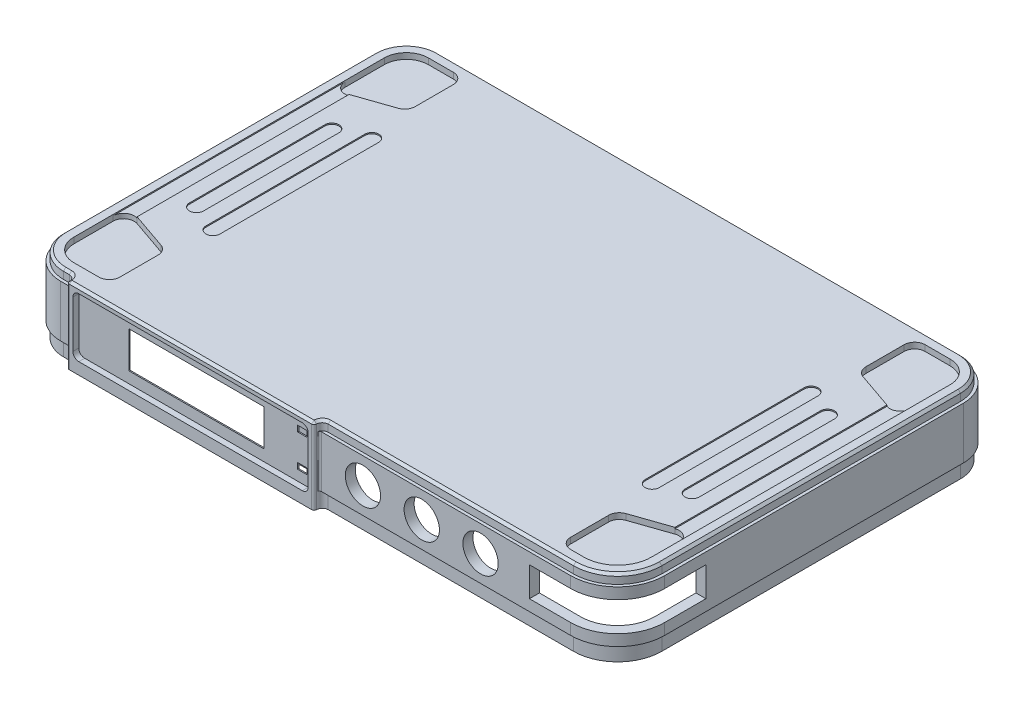
from build123d import *

# Parameters (mm, degrees)
BOSS_EXTRUDE1_DEPTH = 13
CUT_EXTRUDE1_DEPTH  = 1
CUT_EXTRUDE2_DEPTH  = 0.2
CUT_EXTRUDE3_START  = -1.6
CUT_EXTRUDE3_DEPTH  = 1.6
CUT_EXTRUDE4_DEPTH  = 2.6
SKETCH7_W           = 42
SKETCH7_H           = 13
BOSS_EXTRUDE2_DEPTH = 1.4
CUT_EXTRUDE6_DEPTH  = 0.5
CUT_EXTRUDE7_DEPTH  = 1
SKETCH10_R          = 6.5
CUT_EXTRUDE8_DEPTH  = 0.5
FILLET1_R           = 0.4
FILLET2_R           = 1
CHAMFER1_SIZE       = 0.4
CUT_EXTRUDE9_DEPTH  = 11.5
SKETCH12_W          = 23
SKETCH12_H          = 6.2
SKETCH12_W_2        = 1.6
SKETCH12_H_2        = 1
CUT_EXTRUDE10_DEPTH = 12
SKETCH13_R          = 4
CUT_EXTRUDE11_DEPTH = 12
SKETCH14_R          = 2.25
CUT_EXTRUDE12_DEPTH = 12
SKETCH15_R          = 3
SKETCH15_W          = 15
SKETCH15_H          = 5
CUT_EXTRUDE13_DEPTH = 15
BOSS_EXTRUDE6_START = 8.5
SKETCH18_W          = 5.6
SKETCH18_H          = 3
SKETCH18_R          = 0.8
BOSS_EXTRUDE6_DEPTH = 8.5
FILLET6_R           = 1
SKETCH19_R          = 0.6
BOSS_EXTRUDE7_DEPTH = 1.4
CHAMFER2_SIZE       = 0.4
SKETCH20_W          = 1.6
SKETCH20_H          = 1
CUT_EXTRUDE14_DEPTH = 1.1
BOSS_EXTRUDE9_DEPTH = 1


with BuildPart() as part:
    # Sketch1 → Boss-Extrude1 (new body)
    with BuildSketch(Plane(origin=(0, 0, 0), x_dir=(1, 0, 0), z_dir=(0, 1, 0))):
        with BuildLine():
            Line((44.35, 32.39), (-44.35, 32.39))
            ThreePointArc((-44.35, 32.39), (-48.592640687, 30.632640687), (-50.35, 26.39))
            Line((-50.35, 26.39), (-50.35, -26.39))
            ThreePointArc((-50.35, -26.39), (-48.592640687, -30.632640687), (-44.35, -32.39))
            Line((-44.35, -32.39), (42.35, -32.39))
            ThreePointArc((42.35, -32.39), (48.006854249, -30.046854249), (50.35, -24.39))
            Line((50.35, -24.39), (50.35, 26.39))
            ThreePointArc((50.35, 26.39), (48.592640687, 30.632640687), (44.35, 32.39))
        make_face()
    extrude(amount=BOSS_EXTRUDE1_DEPTH)

    # Sketch3 → Cut-Extrude1 (cut)
    with BuildSketch(Plane(origin=(0, 13, 0), x_dir=(1, 0, 0), z_dir=(0, 1, 0))):
        with BuildLine():
            Line((-44.35, -30.13894271), (-40.09894271, -30.13894271))
            ThreePointArc((-40.09894271, -30.13894271), (-38.826150504, -29.611734916), (-38.29894271, -28.33894271))
            Line((-38.29894271, -28.33894271), (-38.29894271, -21.854017959))
            ThreePointArc((-38.29894271, -21.854017959), (-38.633270046, -20.809123878), (-39.512057867, -20.152381635))
            Line((-39.512057867, -20.152381635), (-45.712057867, -18.01403634))
            ThreePointArc((-45.712057867, -18.01403634), (-47.343836791, -18.25), (-48.09894271, -19.715672664))
            Line((-48.09894271, -19.715672664), (-48.09894271, -26.39))
            ThreePointArc((-48.09894271, -26.39), (-47.000902813, -29.040902813), (-44.35, -30.13894271))
        make_face()
        with BuildLine():
            ThreePointArc((48.09894271, -24.39), (46.415116375, -28.455116375), (42.35, -30.13894271))
            Line((42.35, -30.13894271), (40.09894271, -30.13894271))
            ThreePointArc((40.09894271, -30.13894271), (38.826150504, -29.611734916), (38.29894271, -28.33894271))
            Line((38.29894271, -28.33894271), (38.29894271, -21.854017959))
            ThreePointArc((38.29894271, -21.854017959), (38.633270046, -20.809123878), (39.512057867, -20.152381635))
            Line((39.512057867, -20.152381635), (45.712057867, -18.01403634))
            ThreePointArc((45.712057867, -18.01403634), (47.343836791, -18.25), (48.09894271, -19.715672664))
            Line((48.09894271, -19.715672664), (48.09894271, -24.39))
        make_face()
        with BuildLine():
            Line((44.35, 30.13894271), (40.09894271, 30.13894271))
            ThreePointArc((40.09894271, 30.13894271), (38.826150504, 29.611734916), (38.29894271, 28.33894271))
            Line((38.29894271, 28.33894271), (38.29894271, 21.854017959))
            ThreePointArc((38.29894271, 21.854017959), (38.633270046, 20.809123878), (39.512057867, 20.152381635))
            Line((39.512057867, 20.152381635), (45.712057867, 18.01403634))
            ThreePointArc((45.712057867, 18.01403634), (47.343836791, 18.25), (48.09894271, 19.715672664))
            Line((48.09894271, 19.715672664), (48.09894271, 26.39))
            ThreePointArc((48.09894271, 26.39), (47.000902813, 29.040902813), (44.35, 30.13894271))
        make_face()
        with BuildLine():
            ThreePointArc((-48.09894271, 26.39), (-47.000902813, 29.040902813), (-44.35, 30.13894271))
            Line((-44.35, 30.13894271), (-40.09894271, 30.13894271))
            ThreePointArc((-40.09894271, 30.13894271), (-38.826150504, 29.611734916), (-38.29894271, 28.33894271))
            Line((-38.29894271, 28.33894271), (-38.29894271, 21.854017959))
            ThreePointArc((-38.29894271, 21.854017959), (-38.633270046, 20.809123878), (-39.512057867, 20.152381635))
            Line((-39.512057867, 20.152381635), (-45.712057867, 18.01403634))
            ThreePointArc((-45.712057867, 18.01403634), (-47.343836791, 18.25), (-48.09894271, 19.715672664))
            Line((-48.09894271, 19.715672664), (-48.09894271, 26.39))
        make_face()
    extrude(amount=-CUT_EXTRUDE1_DEPTH, mode=Mode.SUBTRACT)

    # Sketch4 → Cut-Extrude2 (cut)
    with BuildSketch(Plane(origin=(0, 13, 0), x_dir=(1, 0, 0), z_dir=(0, 1, 0))):
        with BuildLine():
            Line((-48.09894271, 19.715672664), (-48.09894271, -19.715672664))
            ThreePointArc((-48.09894271, -19.715672664), (-47.343836791, -18.25), (-45.712057867, -18.01403634))
            Line((-45.712057867, -18.01403634), (-45.712057867, 18.01403634))
            ThreePointArc((-45.712057867, 18.01403634), (-47.343836791, 18.25), (-48.09894271, 19.715672664))
        make_face()
        with BuildLine():
            Line((-40.925173024, 11.506557578), (-40.925173024, -11.506557578))
            ThreePointArc((-40.925173024, -11.506557578), (-42.118615445, -12.7), (-43.312057867, -11.506557578))
            Line((-43.312057867, -11.506557578), (-43.312057867, 11.506557578))
            ThreePointArc((-43.312057867, 11.506557578), (-42.118615445, 12.7), (-40.925173024, 11.506557578))
        make_face()
        with BuildLine():
            Line((-36.13828818, 13.506557578), (-36.13828818, -13.506557578))
            ThreePointArc((-36.13828818, -13.506557578), (-37.331730602, -14.7), (-38.525173024, -13.506557578))
            Line((-38.525173024, -13.506557578), (-38.525173024, 13.506557578))
            ThreePointArc((-38.525173024, 13.506557578), (-37.331730602, 14.7), (-36.13828818, 13.506557578))
        make_face()
        with BuildLine():
            Line((40.925173024, 11.506557578), (40.925173024, -11.506557578))
            ThreePointArc((40.925173024, -11.506557578), (42.118615445, -12.7), (43.312057867, -11.506557578))
            Line((43.312057867, -11.506557578), (43.312057867, 11.506557578))
            ThreePointArc((43.312057867, 11.506557578), (42.118615445, 12.7), (40.925173024, 11.506557578))
        make_face()
        with BuildLine():
            Line((36.13828818, 13.506557578), (36.13828818, -13.506557578))
            ThreePointArc((36.13828818, -13.506557578), (37.331730602, -14.7), (38.525173024, -13.506557578))
            Line((38.525173024, -13.506557578), (38.525173024, 13.506557578))
            ThreePointArc((38.525173024, 13.506557578), (37.331730602, 14.7), (36.13828818, 13.506557578))
        make_face()
        with BuildLine():
            Line((45.712057867, 18.01403634), (45.712057867, -18.01403634))
            ThreePointArc((45.712057867, -18.01403634), (47.343836791, -18.25), (48.09894271, -19.715672664))
            Line((48.09894271, -19.715672664), (48.09894271, 19.715672664))
            ThreePointArc((48.09894271, 19.715672664), (47.343836791, 18.25), (45.712057867, 18.01403634))
        make_face()
    extrude(amount=-CUT_EXTRUDE2_DEPTH, mode=Mode.SUBTRACT)

    # Sketch5 → Cut-Extrude3 (cut)
    with BuildSketch(Plane(origin=(0, 13, 0), x_dir=(1, 0, 0), z_dir=(0, 1, 0)).offset(CUT_EXTRUDE3_START)):
        with BuildLine():
            Line((44.35, 32.39), (-44.35, 32.39))
            ThreePointArc((-44.35, 32.39), (-48.592640687, 30.632640687), (-50.35, 26.39))
            Line((-50.35, 26.39), (-50.35, -26.39))
            ThreePointArc((-50.35, -26.39), (-48.592640687, -30.632640687), (-44.35, -32.39))
            Line((-44.35, -32.39), (42.35, -32.39))
            ThreePointArc((42.35, -32.39), (48.006854249, -30.046854249), (50.35, -24.39))
            Line((50.35, -24.39), (50.35, 26.39))
            ThreePointArc((50.35, 26.39), (48.592640687, 30.632640687), (44.35, 32.39))
        make_face()
        with BuildLine():
            Line((44.35, 31.89), (-44.35, 31.89))
            ThreePointArc((-44.35, 31.89), (-48.239087297, 30.279087297), (-49.85, 26.39))
            Line((-49.85, 26.39), (-49.85, -26.39))
            ThreePointArc((-49.85, -26.39), (-48.239087297, -30.279087297), (-44.35, -31.89))
            Line((-44.35, -31.89), (42.35, -31.89))
            ThreePointArc((42.35, -31.89), (47.653300859, -29.693300859), (49.85, -24.39))
            Line((49.85, -24.39), (49.85, 26.39))
            ThreePointArc((49.85, 26.39), (48.239087297, 30.279087297), (44.35, 31.89))
        make_face(mode=Mode.SUBTRACT)
    extrude(amount=CUT_EXTRUDE3_DEPTH, mode=Mode.SUBTRACT)

    # Sketch6 → Cut-Extrude4 (cut)
    with BuildSketch(Plane.XZ):
        with BuildLine():
            Line((-44.35, -32.39), (44.35, -32.39))
            ThreePointArc((44.35, -32.39), (48.592640687, -30.632640687), (50.35, -26.39))
            Line((50.35, -26.39), (50.35, 24.39))
            ThreePointArc((50.35, 24.39), (48.006854249, 30.046854249), (42.35, 32.39))
            Line((42.35, 32.39), (-44.35, 32.39))
            ThreePointArc((-44.35, 32.39), (-48.592640687, 30.632640687), (-50.35, 26.39))
            Line((-50.35, 26.39), (-50.35, -26.39))
            ThreePointArc((-50.35, -26.39), (-48.592640687, -30.632640687), (-44.35, -32.39))
        make_face()
        with BuildLine():
            Line((49.85, -26.39), (49.85, 24.39))
            ThreePointArc((49.85, 24.39), (47.653300859, 29.693300859), (42.35, 31.89))
            Line((42.35, 31.89), (-44.35, 31.89))
            ThreePointArc((-44.35, 31.89), (-48.239087297, 30.279087297), (-49.85, 26.39))
            Line((-49.85, 26.39), (-49.85, -26.39))
            ThreePointArc((-49.85, -26.39), (-48.239087297, -30.279087297), (-44.35, -31.89))
            Line((-44.35, -31.89), (44.35, -31.89))
            ThreePointArc((44.35, -31.89), (48.239087297, -30.279087297), (49.85, -26.39))
        make_face(mode=Mode.SUBTRACT)
    extrude(amount=-CUT_EXTRUDE4_DEPTH, mode=Mode.SUBTRACT)

    # Sketch7 → Boss-Extrude2 (add)
    with BuildSketch(Plane.XY.offset(31.89)):
        with Locations((-21.35, 6.5)):
            Rectangle(SKETCH7_W, SKETCH7_H)
    extrude(amount=BOSS_EXTRUDE2_DEPTH)

    # Sketch8 → Cut-Extrude6 (cut)
    with BuildSketch(Plane.ZY.offset(49.85)):
        with BuildLine():
            ThreePointArc((-22.079215611, 11.4), (-20.400490193, 1.50112313), (-12, 7))
            ThreePointArc((-12, 7), (-12.50112313, 9.400490193), (-13.920784389, 11.4))
            Line((-13.920784389, 11.4), (-22.079215611, 11.4))
        make_face()
        with BuildLine():
            Line((-22.079215611, 11.4), (-13.920784389, 11.4))
            ThreePointArc((-13.920784389, 11.4), (-18, 13), (-22.079215611, 11.4))
        make_face()
        with BuildLine():
            ThreePointArc((22.079215611, 11.4), (18, 13), (13.920784389, 11.4))
            Line((13.920784389, 11.4), (22.079215611, 11.4))
        make_face()
        with BuildLine():
            Line((22.079215611, 11.4), (13.920784389, 11.4))
            ThreePointArc((13.920784389, 11.4), (15.599509807, 1.50112313), (24, 7))
            ThreePointArc((24, 7), (23.49887687, 9.400490193), (22.079215611, 11.4))
        make_face()
        with BuildLine():
            ThreePointArc((4.079215611, 11.4), (0, 13), (-4.079215611, 11.4))
            Line((-4.079215611, 11.4), (4.079215611, 11.4))
        make_face()
        with BuildLine():
            Line((4.079215611, 11.4), (-4.079215611, 11.4))
            ThreePointArc((-4.079215611, 11.4), (-2.400490193, 1.50112313), (6, 7))
            ThreePointArc((6, 7), (5.49887687, 9.400490193), (4.079215611, 11.4))
        make_face()
    extrude(amount=CUT_EXTRUDE6_DEPTH, mode=Mode.SUBTRACT)

    # Sketch9 → Cut-Extrude7 (cut)
    with BuildSketch(Plane.XY.offset(33.29)):
        with BuildLine():
            Line((-40.35, 12), (-2.35, 12))
            ThreePointArc((-2.35, 12), (-1.642893219, 11.707106781), (-1.35, 11))
            Line((-1.35, 11), (-1.35, 3))
            ThreePointArc((-1.35, 3), (-1.642893219, 2.292893219), (-2.35, 2))
            Line((-2.35, 2), (-40.35, 2))
            ThreePointArc((-40.35, 2), (-41.057106781, 2.292893219), (-41.35, 3))
            Line((-41.35, 3), (-41.35, 11))
            ThreePointArc((-41.35, 11), (-41.057106781, 11.707106781), (-40.35, 12))
        make_face()
    extrude(amount=-CUT_EXTRUDE7_DEPTH, mode=Mode.SUBTRACT)

    # Sketch10 → Cut-Extrude8 (cut)
    with BuildSketch(Plane(origin=(0, 0, -31.89), x_dir=(-1, 0, 0), z_dir=(0, 0, -1))):
        with Locations((33.85, 6.5)):
            Circle(SKETCH10_R)
        with BuildLine():
            Line((-23.85, 0), (-34.85, 0))
            ThreePointArc((-34.85, 0), (-41.35, 6.5), (-34.85, 13))
            Line((-34.85, 13), (-23.85, 13))
            ThreePointArc((-23.85, 13), (-17.35, 6.5), (-23.85, 0))
        make_face()
    extrude(amount=CUT_EXTRUDE8_DEPTH, mode=Mode.SUBTRACT)

    # Fillet1
    fillet1_edges = [part.edges().sort_by_distance(p)[0] for p in [
        (-0.35, 7, 32.39),
        (-42.35, 7, 32.39),
        (-0.35, 6.5, 33.29),
        (-42.35, 6.5, 33.29),
    ]]
    fillet(fillet1_edges, radius=FILLET1_R)

    # Fillet2
    fillet2_edges = [part.edges().sort_by_distance(p)[0] for p in [
        (-0.35, 12.2, 31.89),
    ]]
    fillet(fillet2_edges, radius=FILLET2_R - 0.0001)  # a hair under: the kernel refuses the full size
    fillet2_2_edges = [part.edges().sort_by_distance(p)[0] for p in [
        (-42.35, 12.2, 31.89),
    ]]
    fillet(fillet2_2_edges, radius=FILLET2_R - 0.0001)  # a hair under: the kernel refuses the full size

    # Chamfer1
    chamfer1_edges = [part.edges().sort_by_distance(p)[0] for p in [
        (48.239087297, 13, -30.279087297),
        (49.85, 13, -1),
        (47.653300859, 13, 29.693300859),
        (-43.84995, 13, 31.89),
        (-48.239087297, 13, 30.279087297),
        (-49.85, 13, 0),
        (-48.239087297, 13, -30.279087297),
        (0, 13, -31.89),
        (-21.35, 13, 33.29),
        (-0.467157288, 13, 33.172842712),
        (-42.232842712, 13, 33.172842712),
        (21.49995, 13, 31.89),
        (-0.057136071, 13, 32.182863929),
        (-42.642863929, 13, 32.182863929),
    ]]
    chamfer(chamfer1_edges, length=CHAMFER1_SIZE)

    # Sketch11 → Cut-Extrude9 (cut)
    with BuildSketch(Plane.XZ):
        with BuildLine():
            Line((-1.399390153, 32.09), (-41.300609847, 32.09))
            ThreePointArc((-41.300609847, 32.09), (-42.109032635, 31.073409788), (-43.35, 30.69))
            Line((-43.35, 30.69), (-44.35, 30.69))
            ThreePointArc((-44.35, 30.69), (-47.390559159, 29.430559159), (-48.65, 26.39))
            Line((-48.65, 26.39), (-48.65, -26.39))
            ThreePointArc((-48.65, -26.39), (-47.390559159, -29.430559159), (-44.35, -30.69))
            Line((-44.35, -30.69), (44.35, -30.69))
            ThreePointArc((44.35, -30.69), (47.390559159, -29.430559159), (48.65, -26.39))
            Line((48.65, -26.39), (48.65, 24.39))
            ThreePointArc((48.65, 24.39), (46.804772721, 28.844772721), (42.35, 30.69))
            Line((42.35, 30.69), (0.65, 30.69))
            ThreePointArc((0.65, 30.69), (-0.590967365, 31.073409788), (-1.399390153, 32.09))
        make_face()
    extrude(amount=-CUT_EXTRUDE9_DEPTH, mode=Mode.SUBTRACT)

    # Sketch12 → Cut-Extrude10 (cut)
    with BuildSketch(Plane.XY.offset(32.29)):
        with Locations((-21.35, 7)):
            Rectangle(SKETCH12_W, SKETCH12_H)
        with Locations((-3.35, 9.75)):
            Rectangle(SKETCH12_W_2, SKETCH12_H_2)
        with Locations((-3.35, 4.25)):
            Rectangle(SKETCH12_W_2, SKETCH12_H_2)
    extrude(amount=-CUT_EXTRUDE10_DEPTH, mode=Mode.SUBTRACT)

    # Sketch13 → Cut-Extrude11 (cut)
    with BuildSketch(Plane.ZY.offset(49.85)):
        with Locations((-18, 7)):
            Circle(SKETCH13_R)
        with Locations((18, 7)):
            Circle(SKETCH13_R)
        with Locations((0, 7)):
            Circle(SKETCH13_R)
    extrude(amount=-CUT_EXTRUDE11_DEPTH, mode=Mode.SUBTRACT)

    # Sketch14 → Cut-Extrude12 (cut)
    with BuildSketch(Plane(origin=(0, 0, -31.89), x_dir=(-1, 0, 0), z_dir=(0, 0, -1))):
        with Locations((33.85, 6.5)):
            Circle(SKETCH14_R)
        with BuildLine():
            Line((-30.967024337, 9.65), (-21.758292003, 9.65))
            ThreePointArc((-21.758292003, 9.65), (-18.608292003, 6.5), (-21.758292003, 3.35))
            Line((-21.758292003, 3.35), (-30.967024337, 3.35))
            ThreePointArc((-30.967024337, 3.35), (-39.85, 6.5), (-30.967024337, 9.65))
        make_face()
    extrude(amount=-CUT_EXTRUDE12_DEPTH, mode=Mode.SUBTRACT)

    # Sketch15 → Cut-Extrude13 (cut)
    with BuildSketch(Plane.XY.offset(32.39)):
        with Locations((7.05, 7)):
            Circle(SKETCH15_R)
        with Locations((17.05, 7)):
            Circle(SKETCH15_R)
        with Locations((27.05, 7)):
            Circle(SKETCH15_R)
        with Locations((42.85, 7)):
            Rectangle(SKETCH15_W, SKETCH15_H)
    extrude(amount=-CUT_EXTRUDE13_DEPTH, mode=Mode.SUBTRACT)

    # Sketch18 → Boss-Extrude6 (add)
    # profile 1 of 6: a face of its own
    with BuildSketch(Plane.XZ.offset(-11.5).offset(BOSS_EXTRUDE6_START)):
        with Locations((45.85, 9.49)):
            Rectangle(SKETCH18_W, SKETCH18_H)
    # profile 2 of 6: a face of its own
    with BuildSketch(Plane.XZ.offset(-11.5).offset(BOSS_EXTRUDE6_START)):
        with BuildLine():
            ThreePointArc((0.65, 30.69), (-0.364198121, 30.937718727), (-1.15, 31.625088936))
            Line((-1.15, 31.625088936), (-1.15, 30.69))
            Line((-1.15, 30.69), (-8.35, 30.69))
            Line((-8.35, 30.69), (-8.35, 28.49))
            Line((-8.35, 28.49), (-6.35, 28.49))
            Line((-6.35, 28.49), (-6.35, 29.59))
            Line((-6.35, 29.59), (-1.15, 29.59))
            Line((-1.15, 29.59), (-1.15, 28.49))
            Line((-1.15, 28.49), (0.85, 28.49))
            Line((0.85, 28.49), (0.85, 30.69))
            Line((0.85, 30.69), (0.65, 30.69))
        make_face()
    # profile 3 of 6: a face of its own
    with BuildSketch(Plane.XZ.offset(-11.5).offset(BOSS_EXTRUDE6_START)):
        with BuildLine():
            Line((-42.35, 26.39), (-42.35, 30.930408206))
            ThreePointArc((-42.35, 30.930408206), (-42.835753924, 30.750946243), (-43.35, 30.69))
            Line((-43.35, 30.69), (-44.35, 30.69))
            ThreePointArc((-44.35, 30.69), (-47.390559159, 29.430559159), (-48.65, 26.39))
            Line((-48.65, 26.39), (-48.65, 24.39))
            Line((-48.65, 24.39), (-44.35, 24.39))
            ThreePointArc((-44.35, 24.39), (-42.935786438, 24.975786438), (-42.35, 26.39))
        make_face()
        with Locations(Location((-45, 27.04, 0), (0, 0, 270))):
            Circle(SKETCH18_R, mode=Mode.SUBTRACT)
    # profile 4 of 6: a face of its own
    with BuildSketch(Plane.XZ.offset(-11.5).offset(BOSS_EXTRUDE6_START)):
        with BuildLine():
            Line((42.35, -26.39), (42.35, -30.69))
            Line((42.35, -30.69), (44.35, -30.69))
            ThreePointArc((44.35, -30.69), (47.390559159, -29.430559159), (48.65, -26.39))
            Line((48.65, -26.39), (48.65, -24.39))
            Line((48.65, -24.39), (44.35, -24.39))
            ThreePointArc((44.35, -24.39), (42.935786438, -24.975786438), (42.35, -26.39))
        make_face()
        with Locations(Location((45, -27.04, 0), (0, 0, 270))):
            Circle(SKETCH18_R, mode=Mode.SUBTRACT)
    # profile 5 of 6: a face of its own
    with BuildSketch(Plane.XZ.offset(-11.5).offset(BOSS_EXTRUDE6_START)):
        with BuildLine():
            Line((-44.35, -24.39), (-48.65, -24.39))
            Line((-48.65, -24.39), (-48.65, -26.39))
            ThreePointArc((-48.65, -26.39), (-47.390559159, -29.430559159), (-44.35, -30.69))
            Line((-44.35, -30.69), (-42.35, -30.69))
            Line((-42.35, -30.69), (-42.35, -26.39))
            ThreePointArc((-42.35, -26.39), (-42.935786438, -24.975786438), (-44.35, -24.39))
        make_face()
        with Locations(Location((-45, -27.04, 0), (0, 0, 270))):
            Circle(SKETCH18_R, mode=Mode.SUBTRACT)
    # profile 6 of 6: a face of its own
    with BuildSketch(Plane.XZ.offset(-11.5).offset(BOSS_EXTRUDE6_START)):
        with BuildLine():
            Line((33.35, 30.69), (32.05, 30.69))
            Line((32.05, 30.69), (32.05, 30.49))
            ThreePointArc((32.05, 30.49), (31.464213562, 29.075786438), (30.05, 28.49))
            Line((30.05, 28.49), (28.35, 28.49))
            Line((28.35, 28.49), (28.35, 27.19))
            Line((28.35, 27.19), (30.05, 27.19))
            ThreePointArc((30.05, 27.19), (32.383452378, 28.156547622), (33.35, 30.49))
            Line((33.35, 30.49), (33.35, 30.69))
        make_face()
    extrude(amount=-BOSS_EXTRUDE6_DEPTH)

    # Fillet6
    fillet6_edges = [part.edges().sort_by_distance(p)[0] for p in [
        (43.05, 7.25, 10.99),
        (43.05, 7.25, 7.99),
    ]]
    fillet(fillet6_edges, radius=FILLET6_R)

    # Sketch19 → Boss-Extrude7 (add)
    with BuildSketch(Plane.XZ.offset(-3)):
        with Locations(Location((45.05, 9.489965782, 0), (0, 0, 270))):
            Circle(SKETCH19_R)
    extrude(amount=BOSS_EXTRUDE7_DEPTH)

    # Chamfer2
    chamfer2_edges = [part.edges().sort_by_distance(p)[0] for p in [
        (45.05, 1.6, 10.089965782),
    ]]
    chamfer(chamfer2_edges, length=CHAMFER2_SIZE)

    # Sketch20 → Cut-Extrude14 (cut)
    with BuildSketch(Plane(origin=(0, 0, 29.59), x_dir=(-1, 0, 0), z_dir=(0, 0, -1))):
        with Locations((3.35, 4.25)):
            Rectangle(SKETCH20_W, SKETCH20_H)
        with Locations((3.35, 9.75)):
            Rectangle(SKETCH20_W, SKETCH20_H)
    extrude(amount=-CUT_EXTRUDE14_DEPTH, mode=Mode.SUBTRACT)

    # Sketch22 → Boss-Extrude9 (add)
    with BuildSketch(Plane.XZ):
        with BuildLine():
            Line((0.65, 31.89), (0.65, 30.69))
            Line((0.65, 30.69), (-43.35, 30.69))
            Line((-43.35, 30.69), (-43.35, 31.89))
            ThreePointArc((-43.35, 31.89), (-42.642893219, 32.182893219), (-42.35, 32.89))
            ThreePointArc((-42.35, 32.89), (-42.232842712, 33.172842712), (-41.95, 33.29))
            Line((-41.95, 33.29), (-0.75, 33.29))
            ThreePointArc((-0.75, 33.29), (-0.467157288, 33.172842712), (-0.35, 32.89))
            ThreePointArc((-0.35, 32.89), (-0.057106781, 32.182893219), (0.65, 31.89))
        make_face()
    extrude(amount=-BOSS_EXTRUDE9_DEPTH)


solid = part.part
